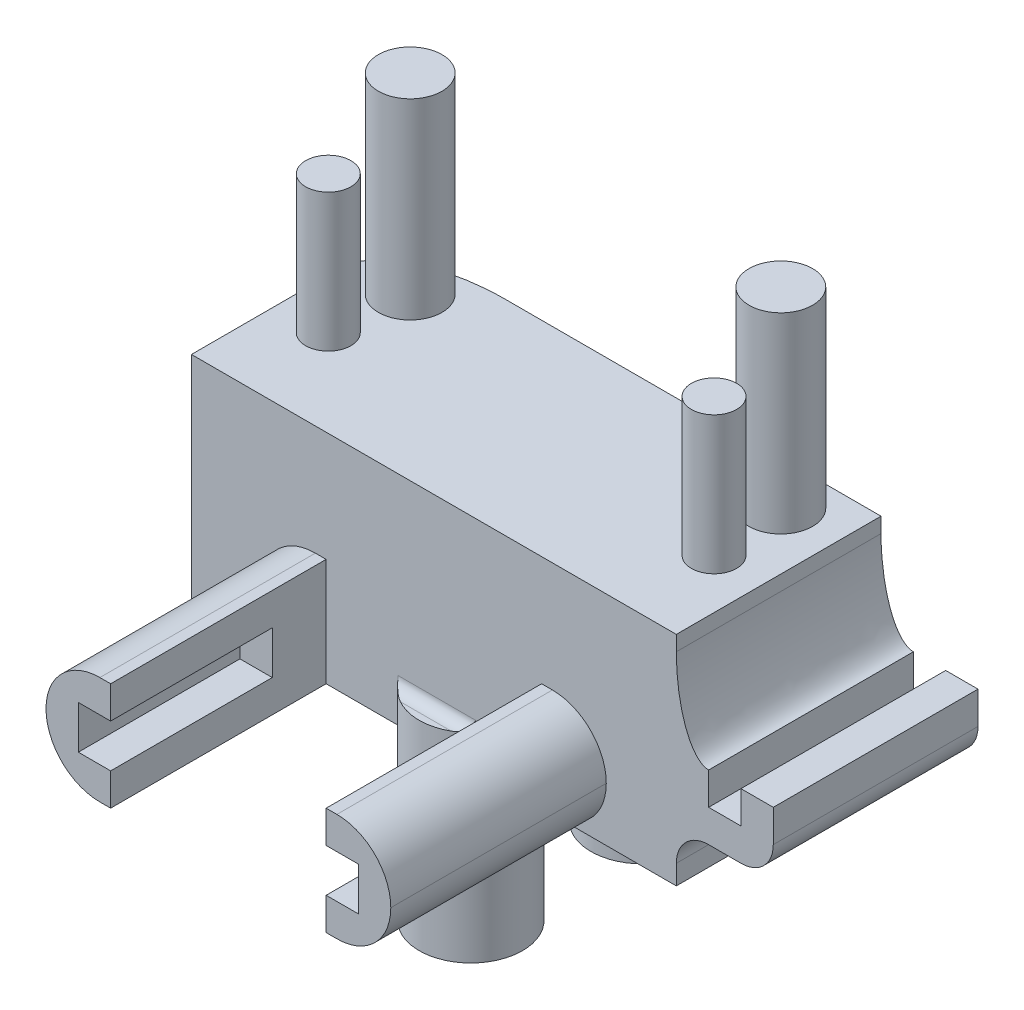
from build123d import *

# Parameters (mm, degrees)
SKETCH1_W                = 22.5
SKETCH1_H                = 7
BOSS_EXTRUDE1_DEPTH      = 1.5
SKETCH2_R                = 1.475
BOSS_EXTRUDE2_DEPTH      = 11.5
SKETCH3_R                = 1.05
BOSS_EXTRUDE3_DEPTH      = 9
BOSS_EXTRUDE4_DEPTH      = 6
BOSS_EXTRUDE4_DEPTH_BACK = 1.5
SKETCH4_W                = 22.5
SKETCH4_H                = 2.5
SKETCH4_H_2              = 7
SKETCH8_W                = 22.5
SKETCH8_H                = 9.5
BOSS_EXTRUDE7_DEPTH      = 2.61
BOSS_EXTRUDE8_DEPTH      = 7.76
BOSS_EXTRUDE8_DEPTH_BACK = 1.5
SKETCH9_R                = 2.4
SKETCH11_W               = 9.5
SKETCH11_H               = 3
BOSS_EXTRUDE9_DEPTH      = 4.5
SKETCH16_W               = 1.5
SKETCH16_H               = 9.5
CUT_EXTRUDE2_DEPTH       = 1.5
SKETCH19_W               = 3
SKETCH19_H               = 5
BOSS_EXTRUDE10_DEPTH     = 10
SKETCH20_W               = 13
SKETCH20_H               = 2
CUT_EXTRUDE3_DEPTH       = 7.5
FILLET1_SIZE             = 4
FILLET1_SIZE_2           = 1.5
FILLET2_R                = 1.5
FILLET3_R                = 1.5
FILLET4_R                = 2
FILLET5_R                = 0.5
FILLET6_SIZE             = 5
FILLET6_SIZE_2           = 2.5
FILLET7_R                = 2.5
FILLET8_R                = 2.5
FILLET9_R                = 2.5
FILLET10_R               = 2.5


# Some blends are built 0.0001 mm under size
with BuildPart() as part:
    # Sketch1 → Boss-Extrude1 (new body)
    with BuildSketch(Plane(origin=(0, 0, 0), x_dir=(1, 0, 0), z_dir=(0, 1, 0))):
        with Locations((-28.93578967, -21.079480712)):
            Rectangle(SKETCH1_W, SKETCH1_H)
    extrude(amount=BOSS_EXTRUDE1_DEPTH)

    # Sketch2 → Boss-Extrude2 (add)
    with BuildSketch(Plane(origin=(0, 1.5, 0), x_dir=(1, 0, 0), z_dir=(0, 1, 0))):
        with Locations(Location((-37.53578967, -19.579480712, 0), (0, 0, 90))):
            Circle(SKETCH2_R)
        with Locations(Location((-20.33578967, -19.579480712, 0), (0, 0, 90))):
            Circle(SKETCH2_R)
    extrude(amount=BOSS_EXTRUDE2_DEPTH)

    # Sketch3 → Boss-Extrude3 (add)
    with BuildSketch(Plane(origin=(0, 1.5, 0), x_dir=(1, 0, 0), z_dir=(0, 1, 0))):
        with Locations(Location((-37.88578967, -23.029480712, 0), (0, 0, 90))):
            Circle(SKETCH3_R)
        with Locations(Location((-19.98578967, -23.029480712, 0), (0, 0, 90))):
            Circle(SKETCH3_R)
    extrude(amount=BOSS_EXTRUDE3_DEPTH)

    # Sketch4 → Boss-Extrude4 (add, two sides: drawn at the far end of the back side and taken through both)
    with BuildSketch(Plane(origin=(0, 0, 0), x_dir=(-1, 0, 0), z_dir=(0, -1, 0)).offset(-BOSS_EXTRUDE4_DEPTH_BACK)):
        with Locations((28.93578967, -25.829480712)):
            Rectangle(SKETCH4_W, SKETCH4_H)
        with Locations((28.93578967, -21.079480712)):
            Rectangle(SKETCH4_W, SKETCH4_H_2)
    extrude(amount=BOSS_EXTRUDE4_DEPTH + BOSS_EXTRUDE4_DEPTH_BACK)

    # Sketch8 → Boss-Extrude7 (add)
    with BuildSketch(Plane(origin=(0, 1.5, 0), x_dir=(1, 0, 0), z_dir=(0, 1, 0))):
        with Locations((-28.93578967, -22.329480712)):
            Rectangle(SKETCH8_W, SKETCH8_H)
    extrude(amount=BOSS_EXTRUDE7_DEPTH)

    # Sketch9 → Boss-Extrude8 (add, two sides: drawn at the far end of the back side and taken through both)
    with BuildSketch(Plane(origin=(0, -6, 0), x_dir=(-1, 0, 0), z_dir=(0, -1, 0)).offset(-BOSS_EXTRUDE8_DEPTH_BACK)):
        with Locations(Location((28.81078967, -25.489480712, 0), (0, 0, 90))):
            Circle(SKETCH9_R)
        with Locations(Location((28.81078967, -17.519480712, 0), (0, 0, 90))):
            Circle(SKETCH9_R)
    extrude(amount=BOSS_EXTRUDE8_DEPTH + BOSS_EXTRUDE8_DEPTH_BACK)

    # Sketch11 → Boss-Extrude9 (add)
    with BuildSketch(Plane(origin=(-17.68578967, 0, 0), x_dir=(0, 0, -1), z_dir=(1, 0, 0))):
        with Locations((-22.329480712, -2.09)):
            Rectangle(SKETCH11_W, SKETCH11_H)
    extrude(amount=BOSS_EXTRUDE9_DEPTH)

    # Sketch16 → Cut-Extrude2 (cut)
    with BuildSketch(Plane(origin=(0, -0.59, 0), x_dir=(1, 0, 0), z_dir=(0, 1, 0))):
        with Locations((-15.43578967, -22.329480712)):
            Rectangle(SKETCH16_W, SKETCH16_H)
    extrude(amount=-CUT_EXTRUDE2_DEPTH, mode=Mode.SUBTRACT)

    # Sketch19 → Boss-Extrude10 (add)
    with BuildSketch(Plane.XY.offset(27.079480712)):
        with Locations((-22.43578967, -3.5)):
            Rectangle(SKETCH19_W, SKETCH19_H)
        with Locations((-35.43578967, -3.5)):
            Rectangle(SKETCH19_W, SKETCH19_H)
    extrude(amount=BOSS_EXTRUDE10_DEPTH)

    # Sketch20 → Cut-Extrude3 (cut)
    with BuildSketch(Plane.XY.offset(37.079480712)):
        with Locations((-28.93578967, -3.5)):
            Rectangle(SKETCH20_W, SKETCH20_H)
    extrude(amount=-CUT_EXTRUDE3_DEPTH, mode=Mode.SUBTRACT)

    # Fillet1
    # an asymmetric fillet: 4, 1.5 mm, written as the material it adds along each edge
    with BuildSketch(Plane(origin=(-17.68578967, -0.59, 17.579480712), x_dir=(0, 1, 0), z_dir=(0, 0, 1))) as fillet1_piece_1:
        with BuildLine():
            Bezier((FILLET1_SIZE, 0), (0, 0), (0, -FILLET1_SIZE_2), weights=[1, 0.707106781, 1])
            Line((0, -FILLET1_SIZE_2), (0, 0))
            Line((0, 0), (FILLET1_SIZE, 0))
        make_face()
    extrude(amount=9.5)

    # Fillet2
    fillet2_edges = [part.edges().sort_by_distance(p)[0] for p in [
        (-17.68578967, -3.59, 22.329480712),
    ]]
    fillet(fillet2_edges, radius=FILLET2_R)

    # Fillet3
    fillet3_edges = [part.edges().sort_by_distance(p)[0] for p in [
        (-13.18578967, -3.59, 22.329480712),
    ]]
    fillet(fillet3_edges, radius=FILLET3_R)

    # Fillet4
    fillet4_edges = [part.edges().sort_by_distance(p)[0] for p in [
        (-28.81078967, -4.5, 17.579480712),
    ]]
    fillet(fillet4_edges, radius=FILLET4_R)

    # Fillet5
    fillet5_edges = [part.edges().sort_by_distance(p)[0] for p in [
        (-28.81078967, -4.5, 27.079480712),
    ]]
    fillet(fillet5_edges, radius=FILLET5_R)

    # Fillet6
    # an asymmetric fillet: 5, 2.5 mm, written as the material it takes off along each edge
    with BuildSketch(Plane(origin=(-40.18578967, 16.61, 17.579480712), x_dir=(1, 0, 0), z_dir=(0, -1, 0))) as fillet6_piece_1:
        with BuildLine():
            Bezier((FILLET6_SIZE, 0), (0, 0), (0, FILLET6_SIZE_2), weights=[1, 0.707106781, 1])
            Line((0, FILLET6_SIZE_2), (0, 0))
            Line((0, 0), (FILLET6_SIZE, 0))
        make_face()
    extrude(amount=35.11, mode=Mode.SUBTRACT)

    # Fillet7
    fillet7_edges = [part.edges().sort_by_distance(p)[0] for p in [
        (-36.93578967, -6, 32.079480712),
    ]]
    fillet(fillet7_edges, radius=FILLET7_R)

    # Fillet8
    fillet8_edges = [part.edges().sort_by_distance(p)[0] for p in [
        (-36.93578967, -1, 32.079480712),
    ]]
    fillet(fillet8_edges, radius=FILLET8_R - 0.0001)  # a hair under: the kernel refuses the full size

    # Fillet9
    fillet9_edges = [part.edges().sort_by_distance(p)[0] for p in [
        (-20.93578967, -1, 32.079480712),
    ]]
    fillet(fillet9_edges, radius=FILLET9_R)

    # Fillet10
    fillet10_edges = [part.edges().sort_by_distance(p)[0] for p in [
        (-20.93578967, -6, 32.079480712),
    ]]
    fillet(fillet10_edges, radius=FILLET10_R - 0.0001)  # a hair under: the kernel refuses the full size


solid = part.part
